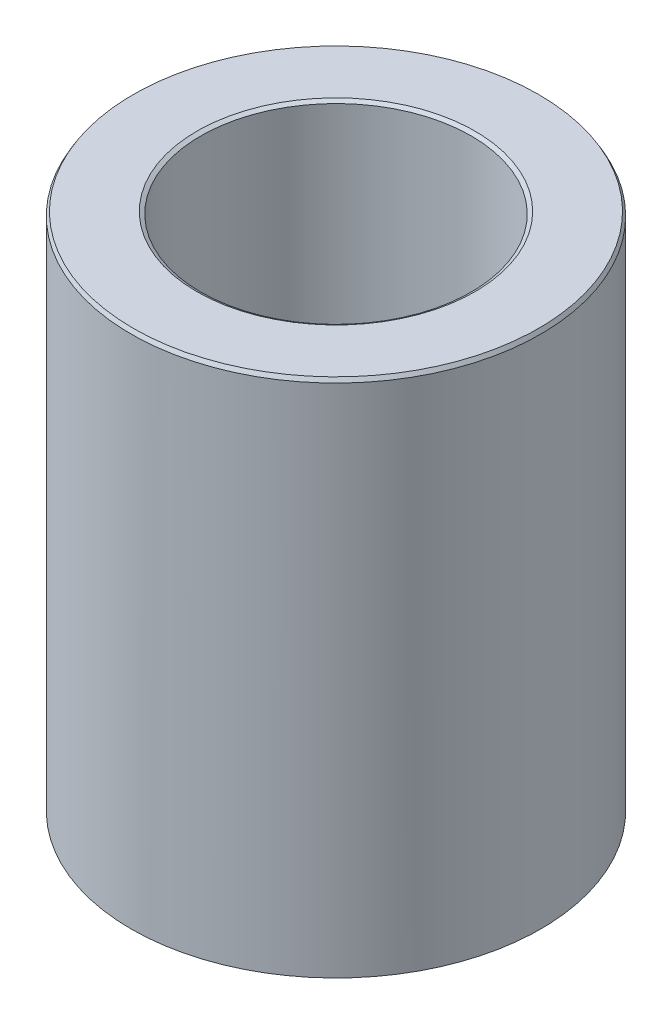
from build123d import *
from OCP.BRepFilletAPI import BRepFilletAPI_MakeChamfer

# Parameters (mm, degrees)
SKETCH1_R           = 40
BOSS_EXTRUDE1_DEPTH = 101.789191785
SKETCH2_R           = 26.411902743
CUT_EXTRUDE1_DEPTH  = 117.451876603
CHAMFER1_SIZE       = 0.748748124
CHAMFER1_SIZE2      = 0.432289931


with BuildPart() as part:
    # Sketch1 → Boss-Extrude1 (new body)
    with BuildSketch(Plane(origin=(0, 0, 0), x_dir=(1, 0, 0), z_dir=(0, 1, 0))):
        Circle(SKETCH1_R)
    extrude(amount=BOSS_EXTRUDE1_DEPTH)

    # Sketch2 → Cut-Extrude1 (cut, through all)
    with BuildSketch(Plane(origin=(0, 0, 0), x_dir=(1, 0, 0), z_dir=(0, 1, 0))):
        Circle(SKETCH2_R)
    extrude(amount=CUT_EXTRUDE1_DEPTH, mode=Mode.SUBTRACT)

    # Chamfer1: one chamfer whose edges measure the first distance from different faces: ONE call of the kernel's chamfer builder (chamfer() names one face for all edges)
    chamfer1_edges_1 = [part.edges().sort_by_distance(p)[0] for p in [
        (-26.411902743, 101.789191785, 0),
    ]]
    chamfer1_side_1 = [part.faces().sort_by_distance(p)[0] for p in [
        (-38.86862915, 101.789191785, 0),
    ]]
    chamfer1_edges_2 = [part.edges().sort_by_distance(p)[0] for p in [
        (-26.411902743, 0, 0),
    ]]
    chamfer1_side_2 = [part.faces().sort_by_distance(p)[0] for p in [
        (-26.411902743, 50.894595893, 0),
    ]]
    chamfer1_edges_3 = [part.edges().sort_by_distance(p)[0] for p in [
        (-40, 0, 0),
    ]]
    chamfer1_side_3 = [part.faces().sort_by_distance(p)[0] for p in [
        (-38.86862915, 0, 0),
    ]]
    chamfer1_edges_4 = [part.edges().sort_by_distance(p)[0] for p in [
        (-40, 101.789191785, 0),
    ]]
    chamfer1_side_4 = [part.faces().sort_by_distance(p)[0] for p in [
        (-40, 50.894595893, 0),
    ]]
    chamfer1 = BRepFilletAPI_MakeChamfer(part.part.solid().wrapped)
    for e in chamfer1_edges_1:
        chamfer1.Add(CHAMFER1_SIZE, CHAMFER1_SIZE2, e.wrapped, chamfer1_side_1[0].wrapped)  # the first distance lies on this face
    for e in chamfer1_edges_2:
        chamfer1.Add(CHAMFER1_SIZE, CHAMFER1_SIZE2, e.wrapped, chamfer1_side_2[0].wrapped)  # the first distance lies on this face
    for e in chamfer1_edges_3:
        chamfer1.Add(CHAMFER1_SIZE, CHAMFER1_SIZE2, e.wrapped, chamfer1_side_3[0].wrapped)  # the first distance lies on this face
    for e in chamfer1_edges_4:
        chamfer1.Add(CHAMFER1_SIZE, CHAMFER1_SIZE2, e.wrapped, chamfer1_side_4[0].wrapped)  # the first distance lies on this face
    add(Compound.cast(chamfer1.Shape()), mode=Mode.REPLACE)


solid = part.part
